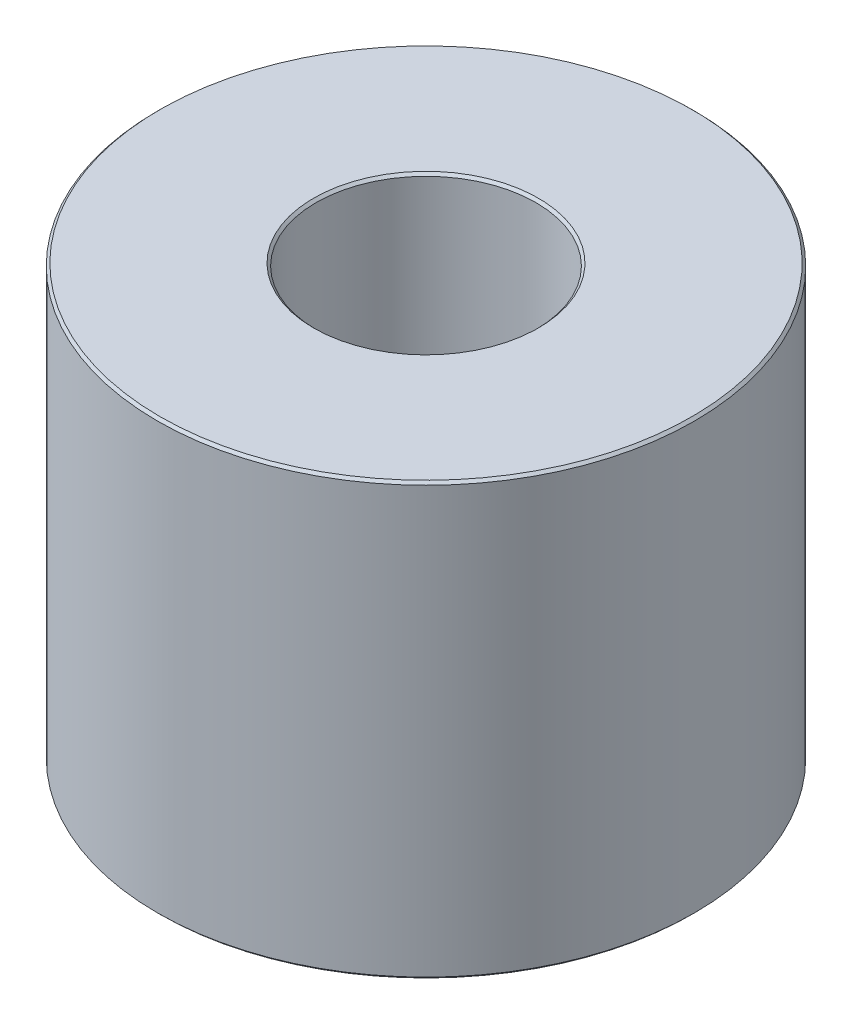
from build123d import *

# Parameters (mm, degrees)
SKETCH1_R           = 52.5
BOSS_EXTRUDE1_DEPTH = 84.2794133
SKETCH2_R           = 21.490356042
CUT_EXTRUDE1_DEPTH  = 113.318829704
CHAMFER1_SIZE       = 0.495466437


with BuildPart() as part:
    # Sketch1 → Boss-Extrude1 (new body)
    with BuildSketch(Plane(origin=(0, 0, 0), x_dir=(1, 0, 0), z_dir=(0, 1, 0))):
        Circle(SKETCH1_R)
    extrude(amount=BOSS_EXTRUDE1_DEPTH)

    # Sketch2 → Cut-Extrude1 (cut, through all)
    with BuildSketch(Plane(origin=(0, 0, 0), x_dir=(1, 0, 0), z_dir=(0, 1, 0))):
        Circle(SKETCH2_R)
    extrude(amount=CUT_EXTRUDE1_DEPTH, mode=Mode.SUBTRACT)

    # Chamfer1
    chamfer1_edges = [part.edges().sort_by_distance(p)[0] for p in [
        (-21.490356042, 84.2794133, 0),
        (-21.490356042, 0, 0),
        (-52.5, 0, 0),
        (-52.5, 84.2794133, 0),
    ]]
    chamfer(chamfer1_edges, length=CHAMFER1_SIZE)


solid = part.part
